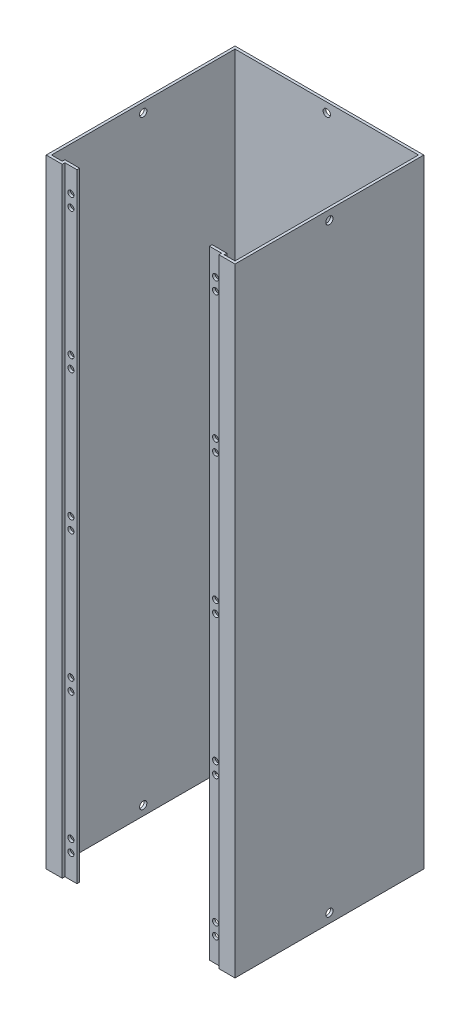
from build123d import *

# Parameters (mm, degrees)
BOSS_EXTRUDE1_DEPTH = 327.5
SKETCH2_R           = 1.6
CUT_EXTRUDE2_DEPTH  = 10
SKETCH3_R           = 1.93
CUT_EXTRUDE3_DEPTH  = 100
SKETCH4_R           = 1.93
CUT_EXTRUDE4_DEPTH  = 10


with BuildPart() as part:
    # Sketch1 → Boss-Extrude1 (new body)
    with BuildSketch(Plane(origin=(0, 0, 0), x_dir=(1, 0, 0), z_dir=(0, 1, 0))):
        Polygon((0, 0), (0, 100), (100, 100), (100, 0), (91.5, 0), (91.5, 1.397), (85.1, 1.397), (85.1, 2.794), (92.897, 2.794), (92.897, 1.397), (98.603, 1.397), (98.603, 98.603), (1.397, 98.603), (1.397, 1.397), (7.103, 1.397), (7.103, 2.794), (14.9, 2.794), (14.9, 1.397), (8.5, 1.397), (8.5, 0), align=None)
    extrude(amount=BOSS_EXTRUDE1_DEPTH)

    # Sketch2 → Cut-Extrude2 (cut)
    with BuildSketch(Plane.XY.offset(-1.397)):
        with Locations((11.7, 314.9)):
            Circle(SKETCH2_R)
        with Locations((11.7, 308.5)):
            Circle(SKETCH2_R)
        with Locations((88.3, 314.9)):
            Circle(SKETCH2_R)
        with Locations((88.3, 308.5)):
            Circle(SKETCH2_R)
        with Locations((11.7, 240.925)):
            Circle(SKETCH2_R)
        with Locations((11.7, 234.525)):
            Circle(SKETCH2_R)
        with Locations((88.3, 240.925)):
            Circle(SKETCH2_R)
        with Locations((88.3, 234.525)):
            Circle(SKETCH2_R)
        with Locations((11.7, 166.95)):
            Circle(SKETCH2_R)
        with Locations((11.7, 160.55)):
            Circle(SKETCH2_R)
        with Locations((88.3, 166.95)):
            Circle(SKETCH2_R)
        with Locations((88.3, 160.55)):
            Circle(SKETCH2_R)
        with Locations((11.7, 92.975)):
            Circle(SKETCH2_R)
        with Locations((11.7, 86.575)):
            Circle(SKETCH2_R)
        with Locations((88.3, 92.975)):
            Circle(SKETCH2_R)
        with Locations((88.3, 86.575)):
            Circle(SKETCH2_R)
        with Locations((11.7, 19)):
            Circle(SKETCH2_R)
        with Locations((11.7, 12.6)):
            Circle(SKETCH2_R)
        with Locations((88.3, 19)):
            Circle(SKETCH2_R)
        with Locations((88.3, 12.6)):
            Circle(SKETCH2_R)
    extrude(amount=-CUT_EXTRUDE2_DEPTH, mode=Mode.SUBTRACT)

    # Sketch3 → Cut-Extrude3 (cut)
    with BuildSketch(Plane(origin=(100, 0, 0), x_dir=(0, 0, -1), z_dir=(1, 0, 0))):
        with Locations((50, 322.524)):
            Circle(SKETCH3_R)
        with Locations((50, 4.976)):
            Circle(SKETCH3_R)
    extrude(amount=-CUT_EXTRUDE3_DEPTH, mode=Mode.SUBTRACT)

    # Sketch4 → Cut-Extrude4 (cut)
    with BuildSketch(Plane(origin=(0, 0, -100), x_dir=(-1, 0, 0), z_dir=(0, 0, -1))):
        with Locations((-50, 322.524)):
            Circle(SKETCH4_R)
        with Locations((-50, 4.976)):
            Circle(SKETCH4_R)
    extrude(amount=-CUT_EXTRUDE4_DEPTH, mode=Mode.SUBTRACT)


solid = part.part
